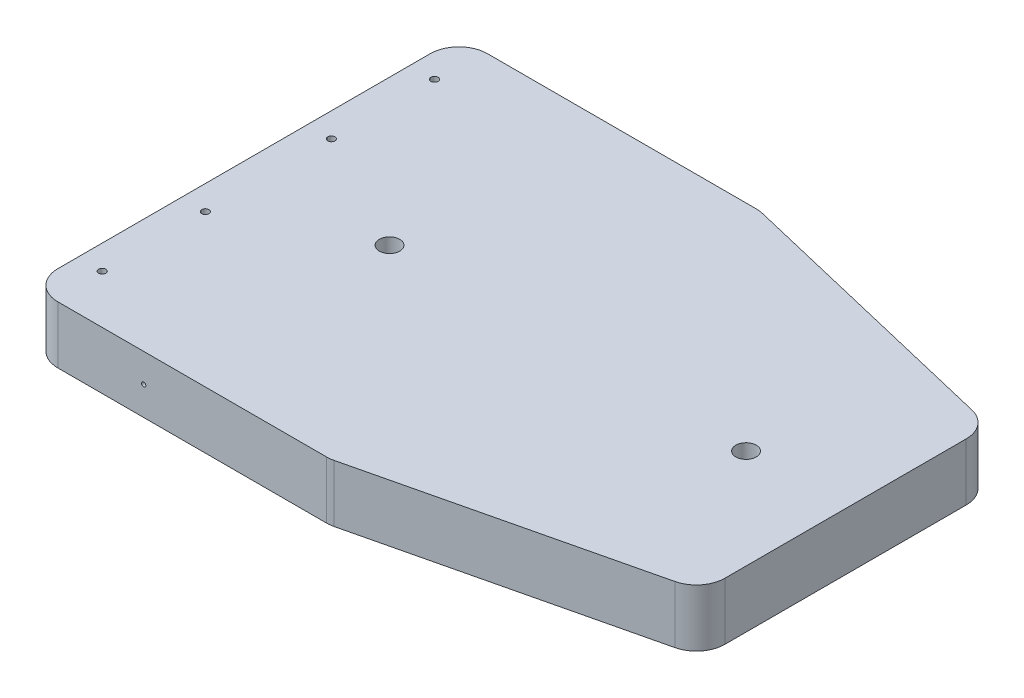
from build123d import *

# Parameters (mm, degrees)
RESSALTO_EXTRUS_O1_DEPTH      = 15
RESSALTO_EXTRUS_O1_DEPTH_BACK = 5
ESBO_O1_R                     = 3.571875
ESBO_O1_R_2                   = 3.57
ESBO_O1_R_3                   = 1.25
FILETE1_R                     = 10
CORTE_EXTRUS_O2_START         = -20
CORTE_EXTRUS_O2_DEPTH         = 10
FILETE2_R                     = 10
ESBO_O7_R                     = 0.75
CORTE_EXTRUS_O3_DEPTH         = 259.505319094


with BuildPart() as part:
    # Esboço1 → Ressalto-extrusão1 (new, two sides: drawn at the far end of the back side and taken through both)
    with BuildSketch(Plane(origin=(0, 0, 0), x_dir=(1, 0, 0), z_dir=(0, 1, 0)).offset(-RESSALTO_EXTRUS_O1_DEPTH_BACK)):
        Polygon((210, 50), (105, 75), (0, 75), (0, -75), (105, -75), (210, -50), align=None)
        with Locations(Location((50.8, 0, 0), (0, 0, 270))):
            Circle(ESBO_O1_R, mode=Mode.SUBTRACT)
        with Locations(Location((175.26, 0, 0), (0, 0, 270))):
            Circle(ESBO_O1_R_2, mode=Mode.SUBTRACT)
        with Locations(Location((8.5, -58, 0), (0, 0, 270))):
            Circle(ESBO_O1_R_3, mode=Mode.SUBTRACT)
        with Locations(Location((8.5, -22, 0), (0, 0, 270))):
            Circle(ESBO_O1_R_3, mode=Mode.SUBTRACT)
        with Locations(Location((8.5, 22, 0), (0, 0, 270))):
            Circle(ESBO_O1_R_3, mode=Mode.SUBTRACT)
        with Locations(Location((8.5, 58, 0), (0, 0, 270))):
            Circle(ESBO_O1_R_3, mode=Mode.SUBTRACT)
    extrude(amount=RESSALTO_EXTRUS_O1_DEPTH + RESSALTO_EXTRUS_O1_DEPTH_BACK)

    # Filete1
    filete1_edges = [part.edges().sort_by_distance(p)[0] for p in [
        (0, 5, 75),
        (0, 5, -75),
        (105, 5, -75),
        (210, 5, -50),
        (210, 5, 50),
        (105, 5, 75),
    ]]
    fillet(filete1_edges, radius=FILETE1_R)

    # Esboço6 → Corte-extrusão2 (cut)
    with BuildSketch(Plane(origin=(0, 15, 0), x_dir=(1, 0, 0), z_dir=(0, 1, 0)).offset(CORTE_EXTRUS_O2_START)):
        with BuildLine():
            Line((200, 21.542333602), (200, 42.101412788))
            Line((200, 42.101412788), (103.82593371, 65))
            Line((103.82593371, 65), (65, 65))
            Line((65, 65), (65, 0))
            Line((65, 0), (148.026211544, 0))
            ThreePointArc((148.026211544, 0), (156.322992627, 19.572148207), (176.158102637, 27.218975832))
            Line((176.158102637, 27.218975832), (200, 21.542333602))
        make_face()
        with BuildLine():
            Line((200, -42.101412788), (200, -21.542333602))
            Line((200, -21.542333602), (176.158102637, -27.218975832))
            ThreePointArc((176.158102637, -27.218975832), (156.322992627, -19.572148207), (148.026211544, 0))
            Line((148.026211544, 0), (65, 0))
            Line((65, 0), (65, -65))
            Line((65, -65), (103.82593371, -65))
            Line((103.82593371, -65), (200, -42.101412788))
        make_face()
    extrude(amount=CORTE_EXTRUS_O2_DEPTH, mode=Mode.SUBTRACT)

    # Filete2
    filete2_edges = [part.edges().sort_by_distance(p)[0] for p in [
        (65, 0, 65),
        (65, 0, -65),
        (103.82593371, 0, -65),
        (200, 0, -21.542333602),
        (176.158102637, 0, -27.218975832),
        (200, 0, -42.101412788),
        (200, 0, 42.101412788),
        (176.158102637, 0, 27.218975832),
        (200, 0, 21.542333602),
    ]]
    fillet(filete2_edges, radius=FILETE2_R - 0.0001)  # a hair under: the kernel refuses the full size

    # Esboço7 → Corte-extrusão3 (cut, through all)
    with BuildSketch(Plane(origin=(0, 0, -75), x_dir=(-1, 0, 0), z_dir=(0, 0, -1))):
        with Locations((-40, 5)):
            Circle(ESBO_O7_R)
    extrude(amount=-CORTE_EXTRUS_O3_DEPTH, mode=Mode.SUBTRACT)


solid = part.part
